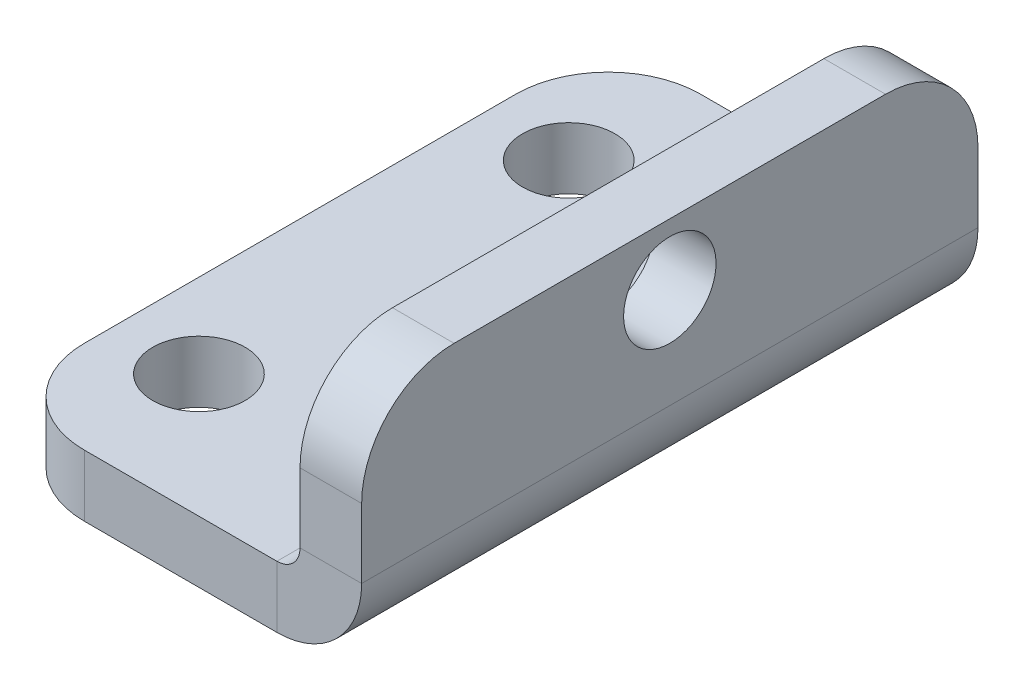
from build123d import *

# Parameters (mm, degrees)
BASE_FLANGE1_DEPTH = 10
FILLET1_R          = 3
SKETCH5_R          = 1.5
CUT_EXTRUDE1_DEPTH = 17.733200531
SKETCH6_R          = 1.5
CUT_EXTRUDE2_DEPTH = 17.248076809


# Sheet-metal steps are written as plain solids
with BuildPart() as part:
    # Sketch2 → Base-Flange1 (new, symmetric)
    with BuildSketch(Plane.XY):
        with BuildLine():
            Line((0, 8), (0, 2.75))
            ThreePointArc((0, 2.75), (-0.805456352, 0.805456352), (-2.75, 0))
            Line((-2.75, 0), (-12, 0))
            Line((-12, 0), (-12, 2))
            Line((-12, 2), (-2.75, 2))
            ThreePointArc((-2.75, 2), (-2.219669914, 2.219669914), (-2, 2.75))
            Line((-2, 2.75), (-2, 8))
            Line((-2, 8), (0, 8))
        make_face()
    extrude(amount=BASE_FLANGE1_DEPTH, both=True)

    # Fillet1
    fillet1_edges = [part.edges().sort_by_distance(p)[0] for p in [
        (-1, 8, 10),
        (-1, 8, -10),
        (-12, 1, 10),
        (-12, 1, -10),
    ]]
    fillet(fillet1_edges, radius=FILLET1_R)

    # Sketch5 → Cut-Extrude1 (cut, through all)
    with BuildSketch(Plane(origin=(0, 2, 0), x_dir=(1, 0, 0), z_dir=(0, 1, 0))):
        with Locations(Location((-9.28, 6, 0), (0, 0, 270))):
            Circle(SKETCH5_R)
        with Locations(Location((-9.28, -6, 0), (0, 0, 270))):
            Circle(SKETCH5_R)
    extrude(amount=-CUT_EXTRUDE1_DEPTH, mode=Mode.SUBTRACT)

    # Sketch6 → Cut-Extrude2 (cut, through all)
    with BuildSketch(Plane.ZY.offset(2)):
        with Locations(Location((0, 6, 0), (0, 0, 270))):
            Circle(SKETCH6_R)
    extrude(amount=-CUT_EXTRUDE2_DEPTH, mode=Mode.SUBTRACT)


solid = part.part
